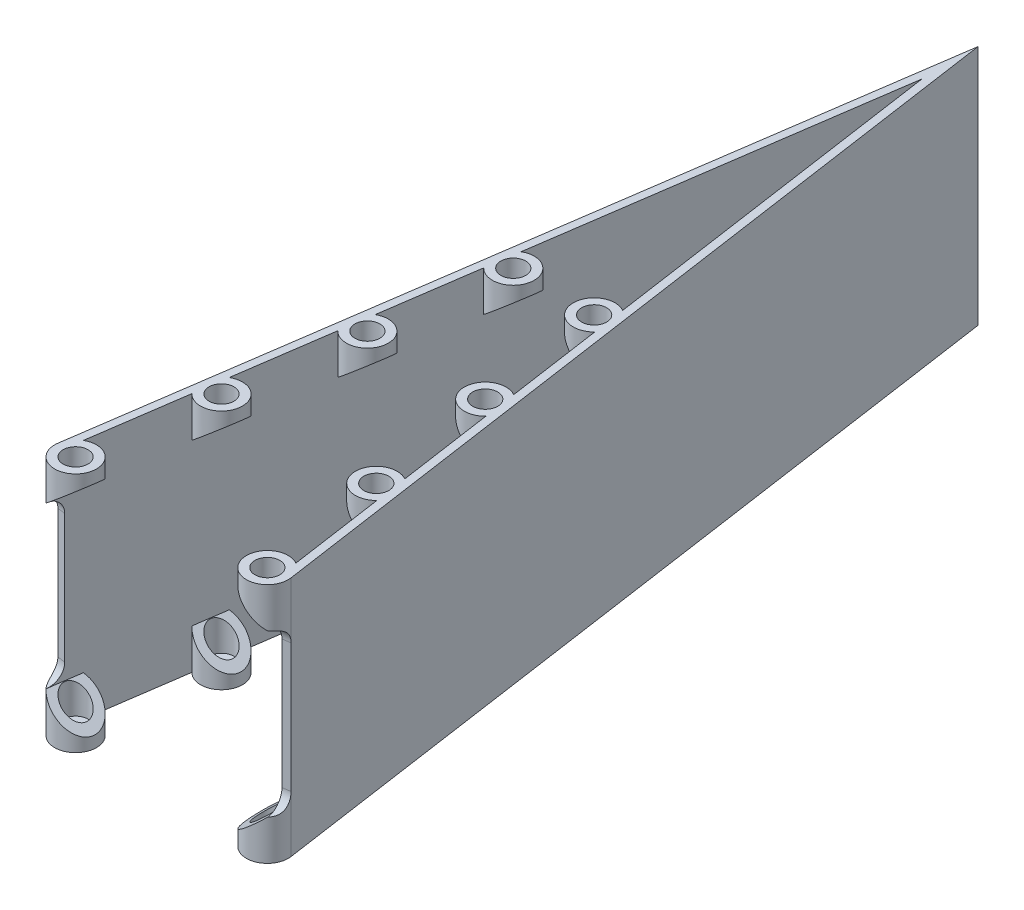
from build123d import *

# Parameters (mm, degrees)
BOSS_EXTRUDE1_DEPTH            = 30
SKETCH2_R                      = 2.6
SKETCH2_R_2                    = 1.55
BOSS_EXTRUDE3_DEPTH            = 5
CUT_EXTRUDE1_REACH             = 109.267
CUT_EXTRUDE1_DIRECTION_2_DEPTH = 108.267308909
CUT_EXTRUDE2_REACH             = 109.267
CUT_EXTRUDE2_DIRECTION_2_DEPTH = 108.267308909
FILLET1_R                      = 2
SKETCH6_R                      = 2.6
BOSS_EXTRUDE4_DEPTH            = 1


with BuildPart() as part:
    # Sketch1 → Boss-Extrude1 (new body)
    with BuildSketch(Plane(origin=(0, 0, 0), x_dir=(1, 0, 0), z_dir=(0, 1, 0))):
        Polygon((-13.5, 0), (0, 93.036251394), (13.5, 0), (14.489635693, 0.143600819), (0, 100), (-14.489635693, 0.143600819), align=None)
    extrude(amount=BOSS_EXTRUDE1_DEPTH)

    # Sketch2 → Boss-Extrude3 (add)
    # profile 1 of 8: a face of its own
    with BuildSketch(Plane(origin=(0, 0, 0), x_dir=(1, 0, 0), z_dir=(0, 1, 0))):
        with Locations((11.916582891, -0.22976131)):
            Circle(SKETCH2_R)
        with Locations(Location((11.916582891, -0.22976131, 0), (0, 0, 270))):
            Circle(SKETCH2_R_2, mode=Mode.SUBTRACT)
    # profile 2 of 8: a face of its own
    with BuildSketch(Plane(origin=(0, 0, 0), x_dir=(1, 0, 0), z_dir=(0, 1, 0))):
        with Locations((9.618969794, 15.604409779)):
            Circle(SKETCH2_R)
        with Locations(Location((9.618969794, 15.604409779, 0), (0, 0, 270))):
            Circle(SKETCH2_R_2, mode=Mode.SUBTRACT)
    # profile 3 of 8: a face of its own
    with BuildSketch(Plane(origin=(0, 0, 0), x_dir=(1, 0, 0), z_dir=(0, 1, 0))):
        with Locations((7.321356697, 31.438580867)):
            Circle(SKETCH2_R)
        with Locations(Location((7.321356697, 31.438580867, 0), (0, 0, 270))):
            Circle(SKETCH2_R_2, mode=Mode.SUBTRACT)
    # profile 4 of 8: a face of its own
    with BuildSketch(Plane(origin=(0, 0, 0), x_dir=(1, 0, 0), z_dir=(0, 1, 0))):
        with Locations((5.0237436, 47.272751956)):
            Circle(SKETCH2_R)
        with Locations(Location((5.0237436, 47.272751956, 0), (0, 0, 270))):
            Circle(SKETCH2_R_2, mode=Mode.SUBTRACT)
    # profile 5 of 8: a face of its own
    with BuildSketch(Plane(origin=(0, 0, 0), x_dir=(1, 0, 0), z_dir=(0, 1, 0))):
        with Locations((-11.916582891, -0.22976131)):
            Circle(SKETCH2_R)
        with Locations(Location((-11.916582891, -0.22976131, 0), (0, 0, 90))):
            Circle(SKETCH2_R_2, mode=Mode.SUBTRACT)
    # profile 6 of 8: a face of its own
    with BuildSketch(Plane(origin=(0, 0, 0), x_dir=(1, 0, 0), z_dir=(0, 1, 0))):
        with Locations((-9.618969794, 15.604409779)):
            Circle(SKETCH2_R)
        with Locations(Location((-9.618969794, 15.604409779, 0), (0, 0, 90))):
            Circle(SKETCH2_R_2, mode=Mode.SUBTRACT)
    # profile 7 of 8: a face of its own
    with BuildSketch(Plane(origin=(0, 0, 0), x_dir=(1, 0, 0), z_dir=(0, 1, 0))):
        with Locations((-7.321356697, 31.438580867)):
            Circle(SKETCH2_R)
        with Locations(Location((-7.321356697, 31.438580867, 0), (0, 0, 90))):
            Circle(SKETCH2_R_2, mode=Mode.SUBTRACT)
    # profile 8 of 8: a face of its own
    with BuildSketch(Plane(origin=(0, 0, 0), x_dir=(1, 0, 0), z_dir=(0, 1, 0))):
        with Locations((-5.0237436, 47.272751956)):
            Circle(SKETCH2_R)
        with Locations(Location((-5.0237436, 47.272751956, 0), (0, 0, 90))):
            Circle(SKETCH2_R_2, mode=Mode.SUBTRACT)
    boss_extrude3 = extrude(amount=BOSS_EXTRUDE3_DEPTH)

    # Cut-Extrude1: up to this face of the body (flat: up to its plane)
    cut_extrude1_end = Plane(part.part.faces().sort_by_distance((-6.677185099, 15.326206653, -47.019934992))[0])
    # Sketch4 → Cut-Extrude1 (cut, up to the picked face)
    with BuildSketch(Plane(origin=(0.278386134, 0, 1.918518691), x_dir=(0.9896356930251445, 0, -0.14360081855839762), z_dir=(0.14360081855839762, 0, 0.9896356930251445)), mode=Mode.PRIVATE) as cut_extrude1_sk1:
        Polygon((13.360081856, 5), (9.160081856, 5), (9.160081856, 1.475781549), align=None)
    cut_extrude1_tool1 = split(extrude(cut_extrude1_sk1.sketch, amount=-CUT_EXTRUDE1_REACH, mode=Mode.PRIVATE), bisect_by=cut_extrude1_end, keep=Keep.BOTH, mode=Mode.PRIVATE)
    cut_extrude1 = cut_extrude1_tool1.solids().sort_by(Axis((10.72902, 3.825261, 0.402082), (-0.14360081855839762, 0, -0.9896356930251445)))[0]
    add(cut_extrude1, mode=Mode.SUBTRACT)

    # Sketch4 → Cut-Extrude1 direction 2 (cut)
    with BuildSketch(Plane(origin=(0.278386134, 0, 1.918518691), x_dir=(0.9896356930251445, 0, -0.14360081855839762), z_dir=(0.14360081855839762, 0, 0.9896356930251445))):
        Polygon((13.360081856, 5), (9.160081856, 5), (9.160081856, 1.475781549), align=None)
    cut_extrude1_direction_2 = extrude(amount=CUT_EXTRUDE1_DIRECTION_2_DEPTH, mode=Mode.SUBTRACT)

    # Cut-Extrude2: up to this face of the body (flat: up to its plane)
    cut_extrude2_end = Plane(part.part.faces().sort_by_distance((6.677185099, 15.326206653, -47.019934992))[0])
    # Sketch5 → Cut-Extrude2 (cut, up to the picked face)
    with BuildSketch(Plane(origin=(-0.278386134, 0, 1.918518691), x_dir=(0.9896356930251446, 0, 0.14360081855839799), z_dir=(-0.14360081855839799, 0, 0.9896356930251446)), mode=Mode.PRIVATE) as cut_extrude2_sk1:
        Polygon((-9.083094078, 5), (-9.083094078, 1.411181133), (-13.360081856, 5), align=None)
    cut_extrude2_tool1 = split(extrude(cut_extrude2_sk1.sketch, amount=-CUT_EXTRUDE2_REACH, mode=Mode.PRIVATE), bisect_by=cut_extrude2_end, keep=Keep.BOTH, mode=Mode.PRIVATE)
    cut_extrude2 = cut_extrude2_tool1.solids().sort_by(Axis((-10.678227, 3.803727, 0.409453), (0.14360081855839799, 0, -0.9896356930251446)))[0]
    add(cut_extrude2, mode=Mode.SUBTRACT)

    # Sketch5 → Cut-Extrude2 direction 2 (cut)
    with BuildSketch(Plane(origin=(-0.278386134, 0, 1.918518691), x_dir=(0.9896356930251446, 0, 0.14360081855839799), z_dir=(-0.14360081855839799, 0, 0.9896356930251446))):
        Polygon((-9.083094078, 5), (-9.083094078, 1.411181133), (-13.360081856, 5), align=None)
    cut_extrude2_direction_2 = extrude(amount=CUT_EXTRUDE2_DIRECTION_2_DEPTH, mode=Mode.SUBTRACT)

    # Mirror2: Boss-Extrude3, Cut-Extrude1, Cut-Extrude1 direction 2, Cut-Extrude2, Cut-Extrude2 direction 2 across plane
    add(boss_extrude3.mirror(Plane.ZX.offset(15)))
    add(cut_extrude1.mirror(Plane.ZX.offset(15)), mode=Mode.SUBTRACT)
    add(cut_extrude1_direction_2.mirror(Plane.ZX.offset(15)), mode=Mode.SUBTRACT)
    add(cut_extrude2.mirror(Plane.ZX.offset(15)), mode=Mode.SUBTRACT)
    add(cut_extrude2_direction_2.mirror(Plane.ZX.offset(15)), mode=Mode.SUBTRACT)

    # Fillet1
    # the kernel refuses this fillet: 2 mm, written as the material it adds along each edge
    with BuildSketch(Plane(origin=(13.5, 25, 0), x_dir=(0, -1, 0), z_dir=(0.9896356930251446, 0, -0.14360081855839765))) as fillet1_piece_1_section:
        with BuildLine():
            CenterArc((FILLET1_R, -FILLET1_R), FILLET1_R, 90, 90)
            Line((0, -FILLET1_R), (0, 0))
            Line((0, 0), (FILLET1_R, 0))
        make_face()
    fillet1_piece_1 = extrude(amount=6, mode=Mode.PRIVATE)
    fillet1_piece_1 = fillet1_piece_1 & Plane(origin=(11.916582891, 24.30002226, 0.22976131), x_dir=(1, 0, 0), z_dir=(0, 1, 0)) * Cylinder(2.6, 21, mode=Mode.PRIVATE)
    add(fillet1_piece_1)
    with BuildSketch(Plane(origin=(-19.437814158, 25, -0.861604911), x_dir=(0, -1, 0), z_dir=(0.9896356930251445, 0, 0.143600818558398))) as fillet1_piece_2_section:
        with BuildLine():
            CenterArc((FILLET1_R, -FILLET1_R), FILLET1_R, 90, 90)
            Line((0, -FILLET1_R), (0, 0))
            Line((0, 0), (FILLET1_R, 0))
        make_face()
    fillet1_piece_2 = extrude(amount=6, mode=Mode.PRIVATE)
    fillet1_piece_2 = fillet1_piece_2 & Plane(origin=(-11.916582891, 24.777637105, 0.22976131), x_dir=(1, 0, 0), z_dir=(0, 1, 0)) * Cylinder(2.6, 21, mode=Mode.PRIVATE)
    add(fillet1_piece_2)
    with BuildSketch(Plane(origin=(13.5, 5, 0), x_dir=(0, 1, 0), z_dir=(0.9896356930251446, 0, -0.14360081855839765))) as fillet1_piece_3_section:
        with BuildLine():
            CenterArc((FILLET1_R, FILLET1_R), FILLET1_R, 180, 90)
            Line((0, FILLET1_R), (0, 0))
            Line((0, 0), (FILLET1_R, 0))
        make_face()
    fillet1_piece_3 = extrude(amount=6, mode=Mode.PRIVATE)
    fillet1_piece_3 = fillet1_piece_3 & Plane(origin=(11.916582891, 5.699977741, 0.22976131), x_dir=(1, 0, 0), z_dir=(0, -1, 0)) * Cylinder(2.6, 21, mode=Mode.PRIVATE)
    add(fillet1_piece_3)
    with BuildSketch(Plane(origin=(-19.437814158, 5, -0.861604911), x_dir=(-0.143600818558398, 0, 0.9896356930251445), z_dir=(0.9896356930251445, 0, 0.143600818558398))) as fillet1_piece_4_section:
        with BuildLine():
            CenterArc((FILLET1_R, -FILLET1_R), FILLET1_R, 90, 90)
            Line((0, -FILLET1_R), (0, 0))
            Line((0, 0), (FILLET1_R, 0))
        make_face()
    fillet1_piece_4 = extrude(amount=6, mode=Mode.PRIVATE)
    fillet1_piece_4 = fillet1_piece_4 & Plane(origin=(-11.916582891, 5.222362792, 0.22976131), x_dir=(1, 0, 0), z_dir=(0, -1, 0)) * Cylinder(2.6, 21, mode=Mode.PRIVATE)
    add(fillet1_piece_4)

    # Sketch6 → Boss-Extrude4 (add)
    with BuildSketch(Plane.XZ):
        with Locations((-9.618969794, -15.604409779)):
            Circle(SKETCH6_R)
        with Locations((9.618969794, -15.604409779)):
            Circle(SKETCH6_R)
        with Locations((7.321356697, -31.438580867)):
            Circle(SKETCH6_R)
        with Locations((-7.321356697, -31.438580867)):
            Circle(SKETCH6_R)
        with Locations((-5.0237436, -47.272751956)):
            Circle(SKETCH6_R)
        with Locations((5.0237436, -47.272751956)):
            Circle(SKETCH6_R)
        with Locations((11.916582891, 0.22976131)):
            Circle(SKETCH6_R)
        with Locations((-11.916582891, 0.22976131)):
            Circle(SKETCH6_R)
    extrude(amount=-BOSS_EXTRUDE4_DEPTH)


solid = part.part
